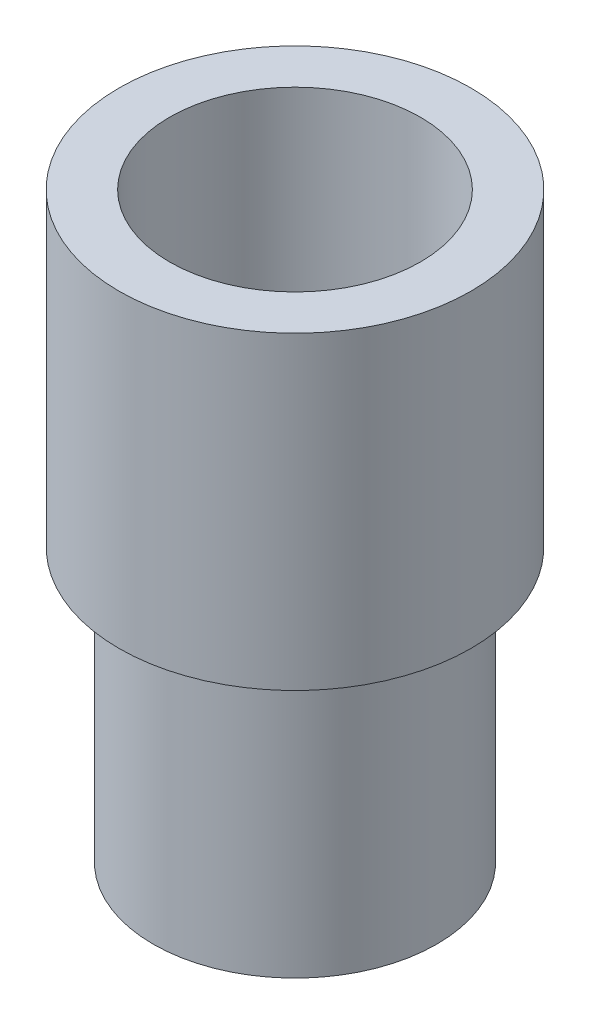
from build123d import *


with BuildPart() as part:
    # Sketch1 → Revolve1 (revolve)
    with BuildSketch(Plane.XY):
        Polygon((13.9954, 30.48), (13.9954, 0), (15.8242, 0), (15.8242, 30.48), (19.6342, 30.48), (19.6342, 65), (13.9954, 65), (13.9954, 40.48), (0, 40.48), (0, 30.48), align=None)
    revolve(axis=Axis((0, 0, 0), (0, 1, 0)))


solid = part.part
